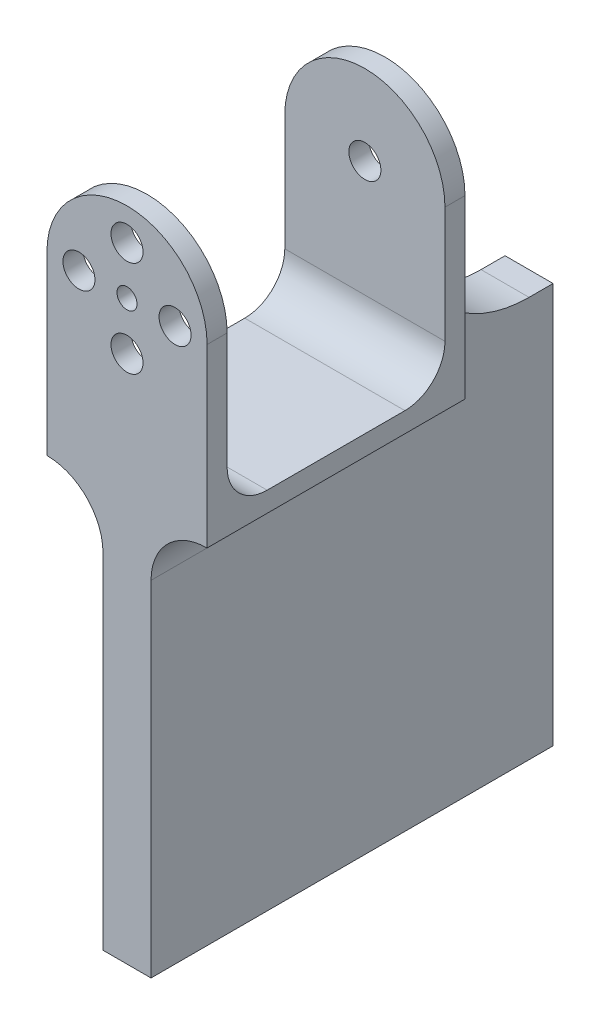
from build123d import *

# Parameters (mm, degrees)
SKETCH2_R           = 10
BOSS_EXTRUDE1_DEPTH = 2.5
SKETCH4_R           = 1.25
CUT_EXTRUDE3_DEPTH  = 10
SKETCH5_R           = 2
CUT_EXTRUDE4_DEPTH  = 10
CIRPATTERN1_COUNT   = 4
BOSS_EXTRUDE2_START = -2.5
BOSS_EXTRUDE2_DEPTH = 2.5
SKETCH8_W           = 20
SKETCH8_H           = 2.5
BOSS_EXTRUDE3_DEPTH = 27.2
BOSS_EXTRUDE4_START = 2.5
SKETCH10_R          = 2
BOSS_EXTRUDE4_DEPTH = 2.5
FILLET1_R           = 5
SKETCH12_W          = 6
SKETCH12_H          = 32.2
BOSS_EXTRUDE5_DEPTH = 50
SKETCH13_W          = 6
SKETCH13_H          = 50
BOSS_EXTRUDE6_DEPTH = 18
FILLET2_R           = 7
FILLET3_R           = 15


with BuildPart() as part:
    # Sketch2 → Boss-Extrude1 (new body)
    with BuildSketch(Plane(origin=(0, 0, 0), x_dir=(-1, 0, 0), z_dir=(0, 0, -1))):
        Circle(SKETCH2_R)
    extrude(amount=-BOSS_EXTRUDE1_DEPTH)

    # Sketch4 → Cut-Extrude3 (cut)
    with BuildSketch(Plane(origin=(0, 0, 0), x_dir=(-1, 0, 0), z_dir=(0, 0, -1))):
        Circle(SKETCH4_R)
    extrude(amount=-CUT_EXTRUDE3_DEPTH, mode=Mode.SUBTRACT)

    # Sketch5 → Cut-Extrude4 (cut)
    with BuildSketch(Plane(origin=(0, 0, 0), x_dir=(-1, 0, 0), z_dir=(0, 0, -1))):
        with Locations((0, 6)):
            Circle(SKETCH5_R)
    cut_extrude4 = extrude(amount=-CUT_EXTRUDE4_DEPTH, mode=Mode.SUBTRACT)

    # CirPattern1: Cut-Extrude4 ×4 about axis
    cirpattern1_axis = Axis((0, 0, 0), (0, 0, 1))
    for i in range(1, CIRPATTERN1_COUNT):
        add(cut_extrude4.rotate(cirpattern1_axis, i * 360 / CIRPATTERN1_COUNT), mode=Mode.SUBTRACT)

    # Sketch6 → Boss-Extrude2 (add)
    with BuildSketch(Plane.XY.offset(2.5).offset(BOSS_EXTRUDE2_START)):
        with BuildLine():
            Line((-10, 0), (-10, -22))
            Line((-10, -22), (10, -22))
            Line((10, -22), (10, 0))
            ThreePointArc((10, 0), (0, -10), (-10, 0))
        make_face()
    extrude(amount=BOSS_EXTRUDE2_DEPTH)

    # Sketch8 → Boss-Extrude3 (add)
    with BuildSketch(Plane(origin=(0, 0, 0), x_dir=(-1, 0, 0), z_dir=(0, 0, -1))):
        with Locations((0, -20.75)):
            Rectangle(SKETCH8_W, SKETCH8_H)
    extrude(amount=BOSS_EXTRUDE3_DEPTH)

    # Sketch10 → Boss-Extrude4 (add)
    with BuildSketch(Plane(origin=(0, 0, -27.2), x_dir=(-1, 0, 0), z_dir=(0, 0, -1)).offset(BOSS_EXTRUDE4_START)):
        with BuildLine():
            Line((-10, -22), (10, -22))
            Line((10, -22), (10, 0))
            ThreePointArc((10, 0), (0, 10), (-10, 0))
            Line((-10, 0), (-10, -22))
        make_face()
        Circle(SKETCH10_R, mode=Mode.SUBTRACT)
    extrude(amount=-BOSS_EXTRUDE4_DEPTH)

    # Fillet1
    fillet1_edges = [part.edges().sort_by_distance(p)[0] for p in [
        (0, -19.5, 0),
        (0, -19.5, -27.2),
    ]]
    fillet(fillet1_edges, radius=FILLET1_R)

    # Sketch12 → Boss-Extrude5 (add)
    with BuildSketch(Plane.XZ.offset(22)):
        with Locations((0, -13.6)):
            Rectangle(SKETCH12_W, SKETCH12_H)
    extrude(amount=BOSS_EXTRUDE5_DEPTH)

    # Sketch13 → Boss-Extrude6 (add)
    with BuildSketch(Plane(origin=(0, 0, -29.7), x_dir=(-1, 0, 0), z_dir=(0, 0, -1))):
        with Locations((0, -47)):
            Rectangle(SKETCH13_W, SKETCH13_H)
    extrude(amount=BOSS_EXTRUDE6_DEPTH)

    # Fillet2
    fillet2_edges = [part.edges().sort_by_distance(p)[0] for p in [
        (-3, -22, -13.6),
        (3, -22, -13.6),
    ]]
    fillet(fillet2_edges, radius=FILLET2_R - 0.0001)  # a hair under: the kernel refuses the full size

    # Fillet3
    fillet3_edges = [part.edges().sort_by_distance(p)[0] for p in [
        (0, -22, -29.7),
    ]]
    fillet(fillet3_edges, radius=FILLET3_R)


solid = part.part
